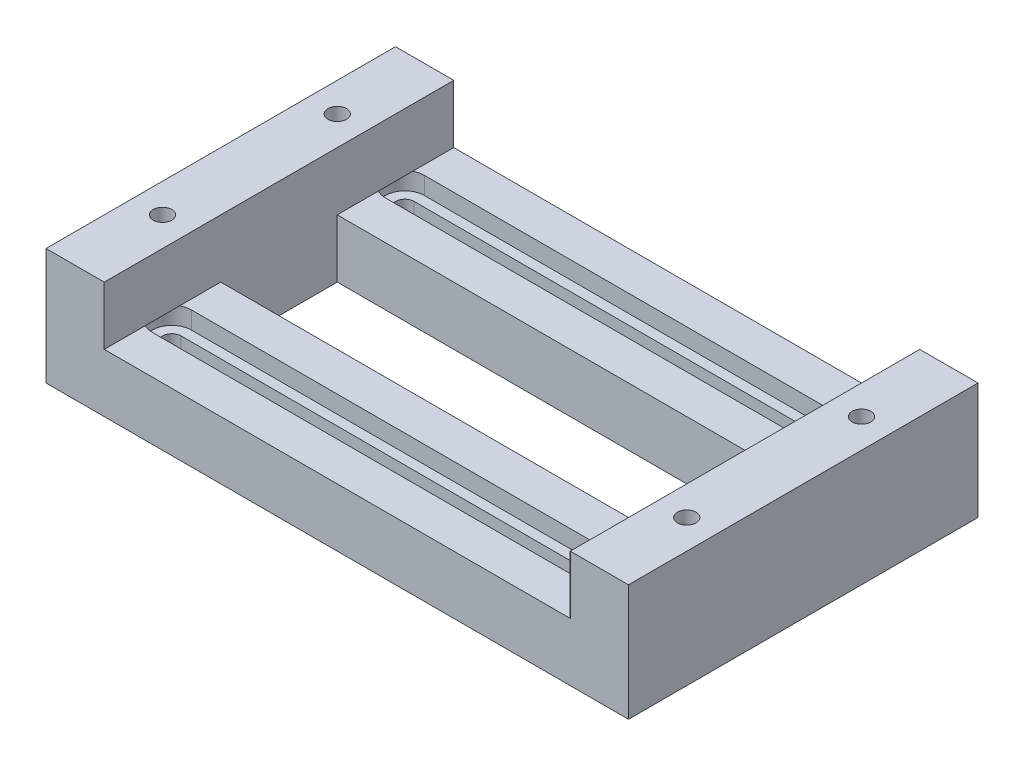
from build123d import *

# Parameters (mm, degrees)
SKETCH1_R             = 1.6
BOSS_EXTRUDE1_DEPTH   = 10
CUT_SLOT_INSETS_DEPTH = 3
SKETCH5_W             = 10
SKETCH5_H             = 60
SKETCH5_R             = 1.6
BOSS_EXTRUDE3_DEPTH   = 10
SKETCH6_R             = 3.75
CUT_EXTRUDE1_DEPTH    = 2.5
CHAMFER1_SIZE         = 0.5


with BuildPart() as part:
    # Sketch1 → Boss-Extrude1 (new body)
    with BuildSketch(Plane(origin=(0, 0, 0), x_dir=(1, 0, 0), z_dir=(0, 1, 0))):
        Polygon((100, 60), (50, 60), (0, 60), (0, 0), (100, 0), align=None)
        with Locations((5, 15)):
            Circle(SKETCH1_R, mode=Mode.SUBTRACT)
        with BuildLine():
            ThreePointArc((11.6, 8.4), (10, 10), (11.6, 11.6))
            Line((11.6, 11.6), (88.4, 11.6))
            ThreePointArc((88.4, 11.6), (90, 10), (88.4, 8.4))
            Line((88.4, 8.4), (11.6, 8.4))
        make_face(mode=Mode.SUBTRACT)
        Polygon((10, 20), (10, 40), (50, 40), (90, 40), (90, 20), align=None, mode=Mode.SUBTRACT)
        with Locations((95, 15)):
            Circle(SKETCH1_R, mode=Mode.SUBTRACT)
        with Locations((5, 45)):
            Circle(SKETCH1_R, mode=Mode.SUBTRACT)
        with BuildLine():
            Line((88.4, 48.4), (50, 48.4))
            Line((50, 48.4), (11.6, 48.4))
            ThreePointArc((11.6, 48.4), (10, 50), (11.6, 51.6))
            Line((11.6, 51.6), (50, 51.6))
            Line((50, 51.6), (88.4, 51.6))
            ThreePointArc((88.4, 51.6), (90, 50), (88.4, 48.4))
        make_face(mode=Mode.SUBTRACT)
        with Locations((95, 45)):
            Circle(SKETCH1_R, mode=Mode.SUBTRACT)
    extrude(amount=BOSS_EXTRUDE1_DEPTH)

    # Sketch3 → Cut-Slot insets (cut)
    with BuildSketch(Plane(origin=(0, 10, 0), x_dir=(1, 0, 0), z_dir=(0, 1, 0))):
        with BuildLine():
            Line((88.4, 13.35), (11.6, 13.35))
            ThreePointArc((11.6, 13.35), (8.25, 10), (11.6, 6.65))
            Line((11.6, 6.65), (88.4, 6.65))
            ThreePointArc((88.4, 6.65), (91.75, 10), (88.4, 13.35))
        make_face()
        with BuildLine():
            Line((88.4, 53.35), (11.6, 53.35))
            ThreePointArc((11.6, 53.35), (8.25, 50), (11.6, 46.65))
            Line((11.6, 46.65), (88.4, 46.65))
            ThreePointArc((88.4, 46.65), (91.75, 50), (88.4, 53.35))
        make_face()
    extrude(amount=-CUT_SLOT_INSETS_DEPTH, mode=Mode.SUBTRACT)

    # Sketch5 → Boss-Extrude3 (add)
    # profile 1 of 2: a face of its own
    with BuildSketch(Plane(origin=(0, 10, 0), x_dir=(1, 0, 0), z_dir=(0, 1, 0))):
        with Locations((5, 30)):
            Rectangle(SKETCH5_W, SKETCH5_H)
        with Locations((5, 15)):
            Circle(SKETCH5_R, mode=Mode.SUBTRACT)
        with Locations((5, 45)):
            Circle(SKETCH5_R, mode=Mode.SUBTRACT)
    # profile 2 of 2: a face of its own
    with BuildSketch(Plane(origin=(0, 10, 0), x_dir=(1, 0, 0), z_dir=(0, 1, 0))):
        with Locations((95, 30)):
            Rectangle(SKETCH5_W, SKETCH5_H)
        with Locations((95, 45)):
            Circle(SKETCH5_R, mode=Mode.SUBTRACT)
        with Locations((95, 15)):
            Circle(SKETCH5_R, mode=Mode.SUBTRACT)
    extrude(amount=BOSS_EXTRUDE3_DEPTH)

    # Sketch6 → Cut-Extrude1 (cut)
    with BuildSketch(Plane.XZ):
        with Locations((5, -45)):
            Circle(SKETCH6_R)
        with Locations((5, -15)):
            Circle(SKETCH6_R)
        with Locations((95, -15)):
            Circle(SKETCH6_R)
        with Locations((95, -45)):
            Circle(SKETCH6_R)
    extrude(amount=-CUT_EXTRUDE1_DEPTH, mode=Mode.SUBTRACT)

    # Chamfer1
    chamfer1_edges = [part.edges().sort_by_distance(p)[0] for p in [
        (50, 0, -51.6),
        (90, 0, -50),
        (10, 0, -50),
        (50, 0, -48.4),
        (50, 0, -8.4),
        (10, 0, -10),
        (90, 0, -10),
        (50, 0, -11.6),
    ]]
    chamfer(chamfer1_edges, length=CHAMFER1_SIZE)


solid = part.part
